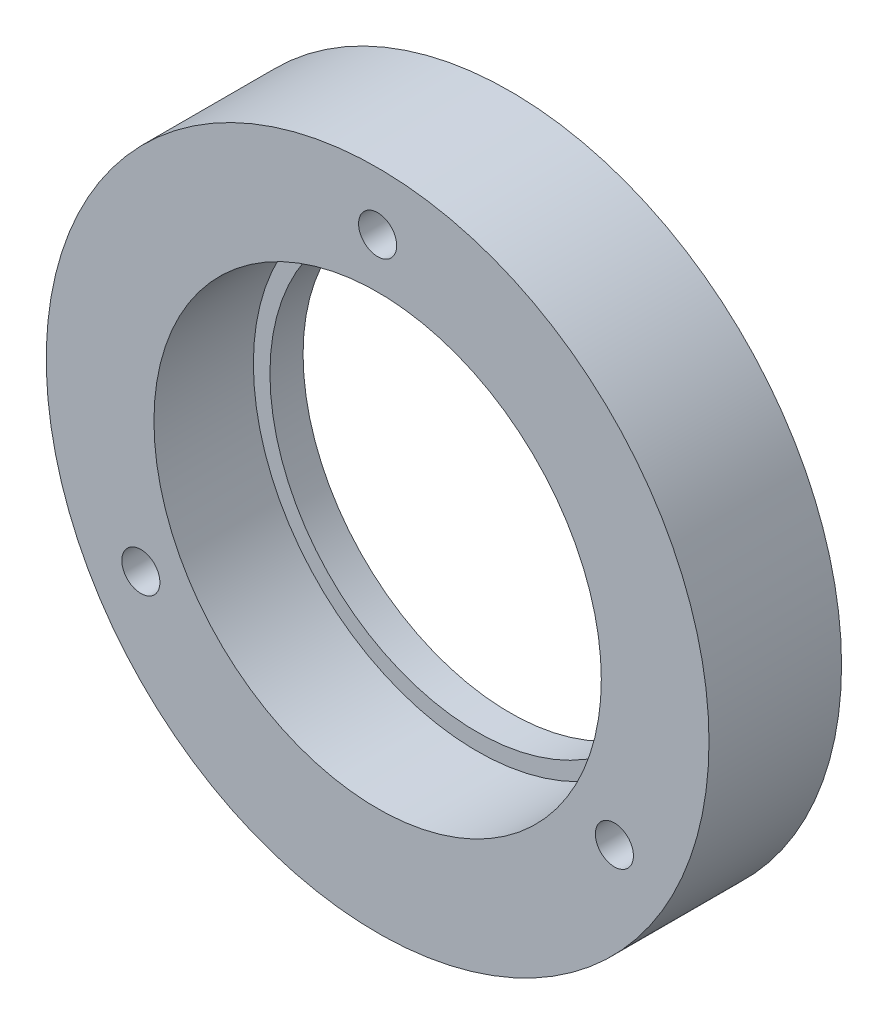
from build123d import *

# Parameters (mm, degrees)
ESQUISSE1_R                  = 20
ESQUISSE1_R_2                = 13.5
BOSS_EXTRU_1_DEPTH           = 8
ESQUISSE2_R                  = 20
ESQUISSE2_R_2                = 12.5
BOSS_EXTRU_2_DEPTH           = 2
ESQUISSE3_R                  = 1.15
ENL_V_MAT_EXTRU_1_DEPTH      = 30.393876913
ENL_V_MAT_EXTRU_2_DEPTH      = 3.5
R_P_TITION_CIRCULAIRE1_COUNT = 3


with BuildPart() as part:
    # Esquisse1 → Boss.-Extru.1 (new body)
    with BuildSketch(Plane.XY):
        Circle(ESQUISSE1_R)
        Circle(ESQUISSE1_R_2, mode=Mode.SUBTRACT)
    extrude(amount=BOSS_EXTRU_1_DEPTH)

    # Esquisse2 → Boss.-Extru.2 (add)
    with BuildSketch(Plane(origin=(0, 0, 0), x_dir=(-1, 0, 0), z_dir=(0, 0, -1))):
        Circle(ESQUISSE2_R)
        Circle(ESQUISSE2_R_2, mode=Mode.SUBTRACT)
    extrude(amount=-BOSS_EXTRU_2_DEPTH)

    # Esquisse3 → Enlèv. mat.-Extru.1 (cut, through all)
    with BuildSketch(Plane(origin=(0, 0, 0), x_dir=(-1, 0, 0), z_dir=(0, 0, -1))):
        with Locations((14.289419162, -8.25)):
            Circle(ESQUISSE3_R)
        with Locations((0, 16.5)):
            Circle(ESQUISSE3_R)
        with Locations((-14.289419162, -8.25)):
            Circle(ESQUISSE3_R)
    extrude(amount=-ENL_V_MAT_EXTRU_1_DEPTH, mode=Mode.SUBTRACT)

    # Esquisse4 → Enlèv. mat.-Extru.2 (cut)
    with BuildSketch(Plane(origin=(0, 0, 0), x_dir=(-1, 0, 0), z_dir=(0, 0, -1))):
        Polygon((0, 14.132863896), (2.05, 15.316431948), (2.05, 17.683568052), (0, 18.867136104), (-2.05, 17.683568052), (-2.05, 15.316431948), align=None)
    enl_v_mat_extru_2 = extrude(amount=-ENL_V_MAT_EXTRU_2_DEPTH, mode=Mode.SUBTRACT)

    # Répétition circulaire1: Enlèv. mat.-Extru.2 ×3 about axis
    r_p_tition_circulaire1_axis = Axis((0, 0, 2), (0, 0, -1))
    for i in range(1, R_P_TITION_CIRCULAIRE1_COUNT):
        add(enl_v_mat_extru_2.rotate(r_p_tition_circulaire1_axis, i * 360 / R_P_TITION_CIRCULAIRE1_COUNT), mode=Mode.SUBTRACT)


solid = part.part
